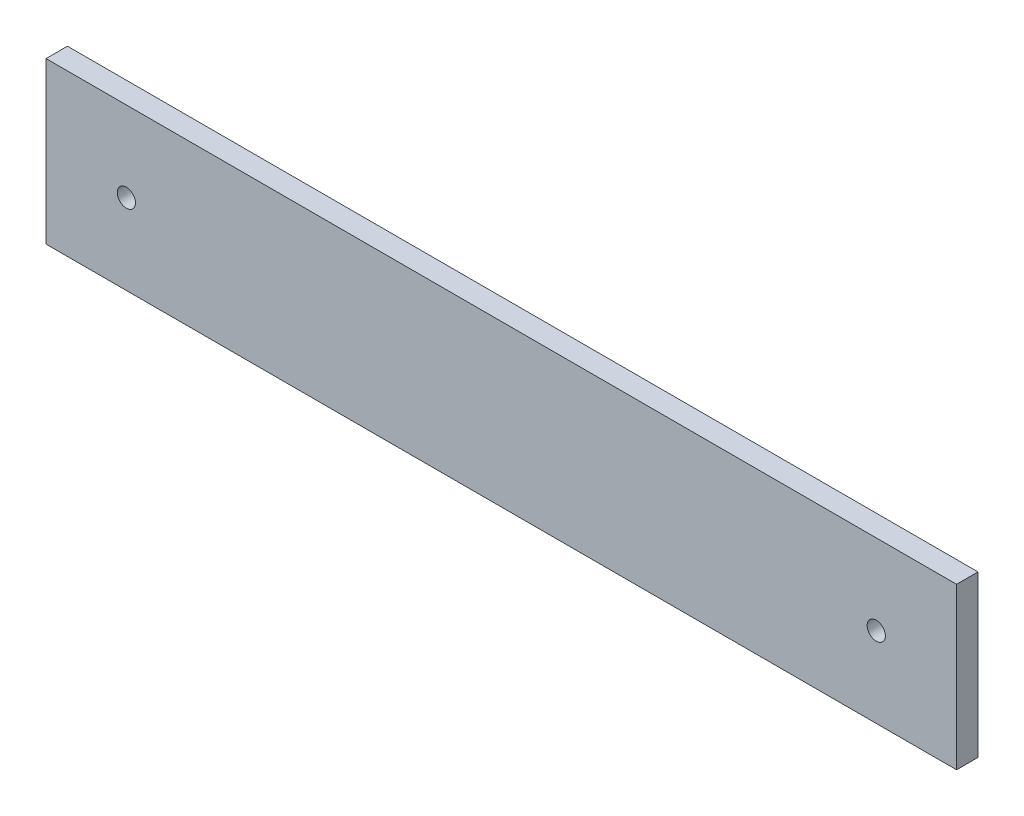
from build123d import *

# Parameters (mm, degrees)
SKETCH_1_W      = 170
SKETCH_1_H      = 30
SKETCH_1_R      = 1.7
EXTRUDE_1_DEPTH = 2


with BuildPart() as part:
    # 草图1 → 凸台-拉伸1 (new, symmetric)
    with BuildSketch(Plane.XY):
        with Locations((70, 0)):
            Rectangle(SKETCH_1_W, SKETCH_1_H)
        Circle(SKETCH_1_R, mode=Mode.SUBTRACT)
        with Locations((140, 0)):
            Circle(SKETCH_1_R, mode=Mode.SUBTRACT)
    extrude(amount=EXTRUDE_1_DEPTH, both=True)


solid = part.part
